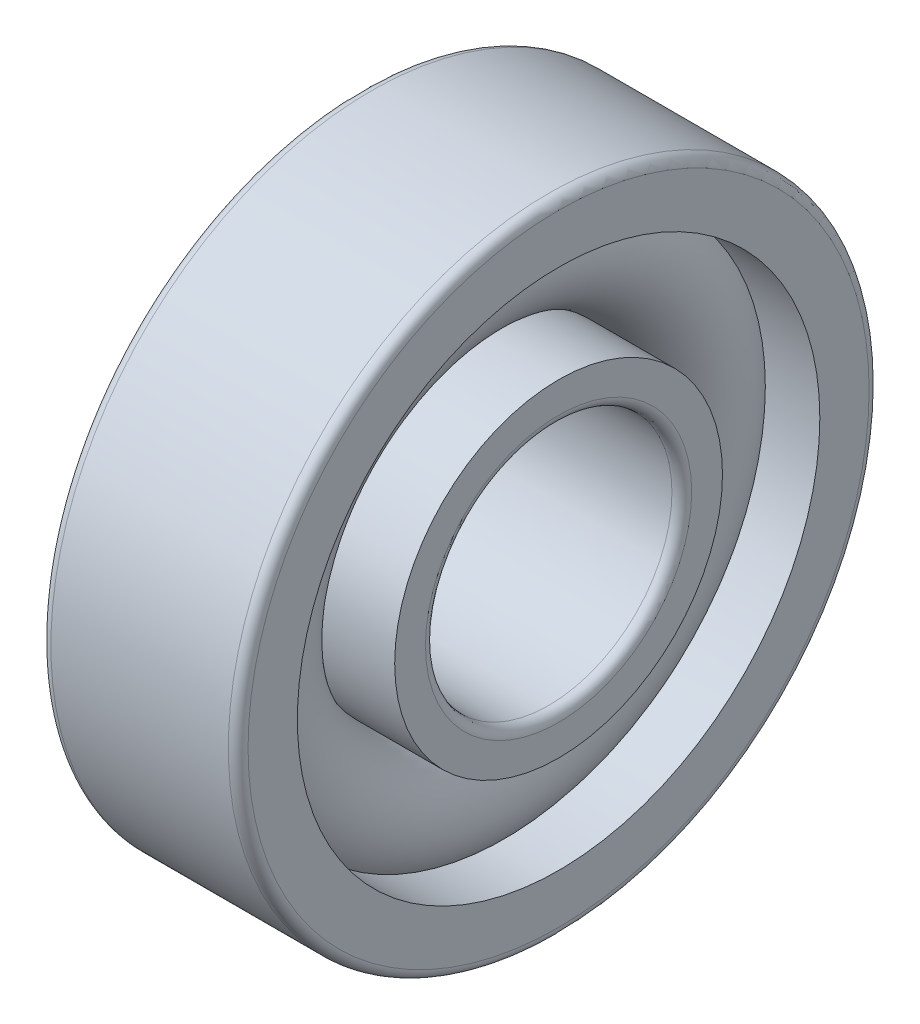
from build123d import *

# Parameters (mm, degrees)
CAGSPISKE_W     = 0.6
CAGSPISKE_H     = 0.4
CAGESPINE_ANGLE = 0.001
BALSIMSKE_R     = 1.2


with BuildPart() as part:
    # CagSpiSke → CageSpine (revolve)
    with BuildSketch(Plane.XY):
        with Locations((0, 4.5)):
            Rectangle(CAGSPISKE_W, CAGSPISKE_H)
    revolve(axis=Axis((-20.6375, 0, 0), (1, 0, 0)), revolution_arc=CAGESPINE_ANGLE)

    # BalSimSke → BallsSimplified (revolve)
    with BuildSketch(Plane.XY):
        with Locations((0, 4.5)):
            Circle(BALSIMSKE_R)
    revolve(axis=Axis((-10, 0, 0), (1, 0, 0)))

    # InnRacSke → InnerRace (revolve)
    with BuildSketch(Plane.XY):
        with BuildLine():
            Line((-0.860595724, 3.7), (-2, 3.7))
            Line((-2, 3.7), (-2, 2.7))
            ThreePointArc((-2, 2.7), (-1.941421356, 2.558578644), (-1.8, 2.5))
            Line((-1.8, 2.5), (1.8, 2.5))
            ThreePointArc((1.8, 2.5), (1.941421356, 2.558578644), (2, 2.7))
            Line((2, 2.7), (2, 3.325))
            Line((2, 3.325), (0, 3.325))
            ThreePointArc((0, 3.325), (-0.469374584, 3.422821974), (-0.860595724, 3.7))
        make_face()
    revolve(axis=Axis((-20.6375, 0, 0), (1, 0, 0)))

    # OutRacSke → OuterRace (revolve)
    with BuildSketch(Plane.XY):
        with BuildLine():
            Line((0, 5.675), (-2, 5.675))
            Line((-2, 5.675), (-2, 6.3))
            ThreePointArc((-2, 6.3), (-1.941421356, 6.441421356), (-1.8, 6.5))
            Line((-1.8, 6.5), (1.8, 6.5))
            ThreePointArc((1.8, 6.5), (1.941421356, 6.441421356), (2, 6.3))
            Line((2, 6.3), (2, 5.3))
            Line((2, 5.3), (0.860595724, 5.3))
            ThreePointArc((0.860595724, 5.3), (0.469374584, 5.577178026), (0, 5.675))
        make_face()
    revolve(axis=Axis((-20.6375, 0, 0), (1, 0, 0)))


solid = part.part
